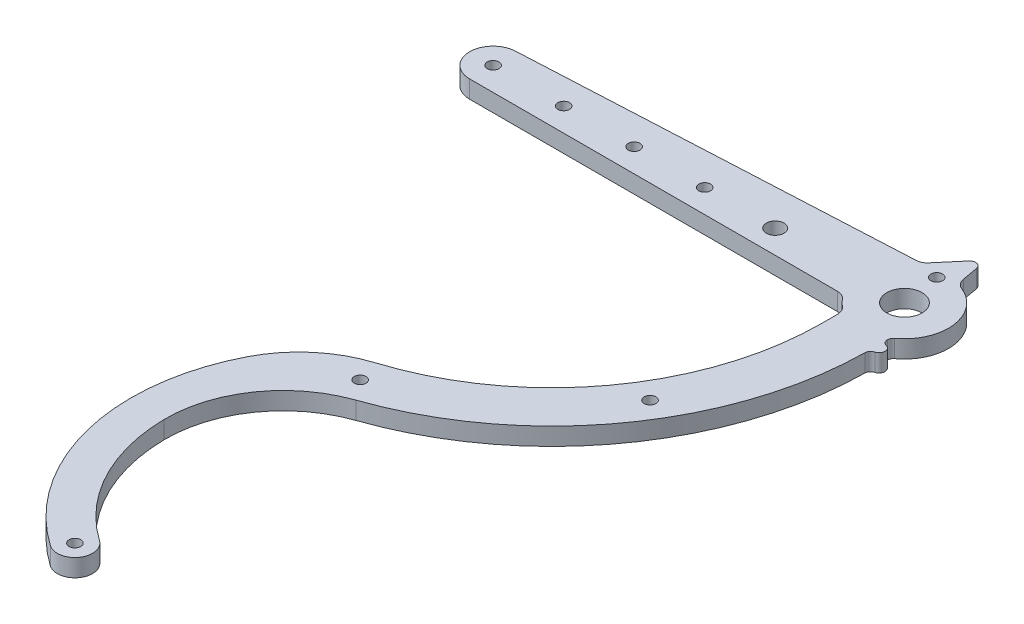
from build123d import *

# Parameters (mm, degrees)
SKETCH_1_R          = 3
EXTRUDE_1_DEPTH     = 3
EXTRUDE_START       = -3
SKETCH_2_R          = 3
EXTRUDE_2_DEPTH     = 3
EXTRUDE_4_DEPTH     = 3
FILLET_1_R          = 20
SKETCH_4_R          = 1
CUT_EXTRUDE_2_DEPTH = 134.77989332
SKETCH_5_R          = 1.5
CUT_EXTRUDE_3_DEPTH = 134.77989332
EXTRUDE_5_DEPTH     = 3
FILLET_2_R          = 2
FILLET_3_R          = 1


with BuildPart() as part:
    # 草图1 → 凸台-拉伸1 (new body)
    with BuildSketch(Plane(origin=(0, 0, 0), x_dir=(1, 0, 0), z_dir=(0, 1, 0))):
        with BuildLine():
            Line((0, 4), (70, 4))
            ThreePointArc((70, 4), (72.828427125, 2.828427125), (74, 0))
            Line((74, 0), (74, -10))
            ThreePointArc((74, -10), (61.386213612, -44.681924543), (29.439223407, -63.157132631))
            ThreePointArc((29.439223407, -63.157132631), (24.635207854, -84.826646437), (36.560916037, -103.546258569))
            ThreePointArc((36.560916037, -103.546258569), (37.297642861, -107.724444011), (33.119457419, -108.461170835))
            ThreePointArc((33.119457419, -108.461170835), (18.340459825, -82.982499926), (28.246224292, -55.243407089))
            ThreePointArc((28.246224292, -55.243407089), (55.321795077, -39.463169658), (66, -10))
            Line((66, -10), (66, -4))
            Line((66, -4), (0, -4))
            ThreePointArc((0, -4), (-4, 0), (0, 4))
        make_face()
        with Locations(Location((70, 0, 0), (0, 0, 270))):
            Circle(SKETCH_1_R, mode=Mode.SUBTRACT)
    extrude(amount=EXTRUDE_1_DEPTH)

    # 草图2 → 凸台-拉伸2 (add)
    with BuildSketch(Plane(origin=(0, 3, 0), x_dir=(1, 0, 0), z_dir=(0, 1, 0)).offset(EXTRUDE_START)):
        with BuildLine():
            Line((0, 4), (69.624462411, 7.490592201))
            ThreePointArc((69.624462411, 7.490592201), (73.786168915, -6.474173689), (63.65571123, 4))
            Line((63.65571123, 4), (0, 4))
        make_face()
        with Locations(Location((70, 0, 0), (0, 0, 270))):
            Circle(SKETCH_2_R, mode=Mode.SUBTRACT)
    extrude(amount=EXTRUDE_2_DEPTH)

    # 草图6 → 凸台-拉伸4 (add)
    with BuildSketch(Plane.XZ):
        with BuildLine():
            Line((70.702827497, -13.290378643), (71.760789381, -7.290378643))
            ThreePointArc((71.760789381, -7.290378643), (70.699822834, -7.467278487), (69.624462411, -7.490592201))
            Line((69.624462411, -7.490592201), (65.624462411, -7.290053937))
            Line((65.624462411, -7.290053937), (70.702827497, -13.290378643))
        make_face()
    extrude(amount=-EXTRUDE_4_DEPTH)

    # 圆角1
    fillet_1_edges = [part.edges().sort_by_distance(p)[0] for p in [
        (29.439223407, 1.5, 63.157132631),
        (28.246224292, 1.5, 55.243407089),
    ]]
    fillet(fillet_1_edges, radius=FILLET_1_R)

    # 草图4 → 切除-拉伸2 (cut, through all)
    with BuildSketch(Plane.XZ):
        with Locations(Location((62.705974414, 36, 0), (0, 0, 270))):
            Circle(SKETCH_4_R)
        with Locations(Location((34.840186728, 106.003714702, 0), (0, 0, 270))):
            Circle(SKETCH_4_R)
        with Locations(Location((0, 0, 0), (0, 0, 270))):
            Circle(SKETCH_4_R)
        with Locations(Location((69, -6.5, 0), (0, 0, 270))):
            Circle(SKETCH_4_R)
        with Locations(Location((12, 0, 0), (0, 0, 270))):
            Circle(SKETCH_4_R)
        with Locations(Location((24, 0, 0), (0, 0, 270))):
            Circle(SKETCH_4_R)
        with Locations(Location((36, 0, 0), (0, 0, 270))):
            Circle(SKETCH_4_R)
        with Locations(Location((35.04334559, 57.673267705, 0), (0, 0, 270))):
            Circle(SKETCH_4_R)
    extrude(amount=-CUT_EXTRUDE_2_DEPTH, mode=Mode.SUBTRACT)

    # 草图5 → 切除-拉伸3 (cut, through all)
    with BuildSketch(Plane(origin=(0, 3, 0), x_dir=(1, 0, 0), z_dir=(0, 1, 0))):
        with Locations(Location((48, 0, 0), (0, 0, 270))):
            Circle(SKETCH_5_R)
    extrude(amount=-CUT_EXTRUDE_3_DEPTH, mode=Mode.SUBTRACT)

    # 草图9 → 凸台-拉伸5 (add)
    with BuildSketch(Plane(origin=(0, 3, 0), x_dir=(1, 0, 0), z_dir=(0, 1, 0)).offset(EXTRUDE_START)):
        with BuildLine():
            Line((74, -10), (74, -6.873863542))
            ThreePointArc((74, -6.873863542), (74.209430585, -7.486235978), (74.75, -7.842109379))
            ThreePointArc((74.75, -7.842109379), (75.499999137, -8.811669003), (74.747455001, -9.779254603))
            ThreePointArc((74.747455001, -9.779254603), (74.20933726, -10.129384674), (73.995002571, -10.734547803))
            ThreePointArc((73.995002571, -10.734547803), (73.998750628, -10.367282401), (74, -10))
        make_face()
    extrude(amount=EXTRUDE_5_DEPTH)

    # 圆角2
    fillet_2_edges = [part.edges().sort_by_distance(p)[0] for p in [
        (0, 1.5, -4),
        (66, 1.5, 6.34428877),
        (63.65571123, 1.5, 4),
        (65.624462411, 1.5, -7.290053937),
        (71.760789381, 1.5, -7.290378643),
    ]]
    fillet(fillet_2_edges, radius=FILLET_2_R)

    # 圆角3
    fillet_3_edges = [part.edges().sort_by_distance(p)[0] for p in [
        (70.702827497, 1.5, -13.290378643),
        (74, 1.5, 6.34428877),
    ]]
    fillet(fillet_3_edges, radius=FILLET_3_R - 0.0001)  # a hair under: the kernel refuses the full size


solid = part.part
